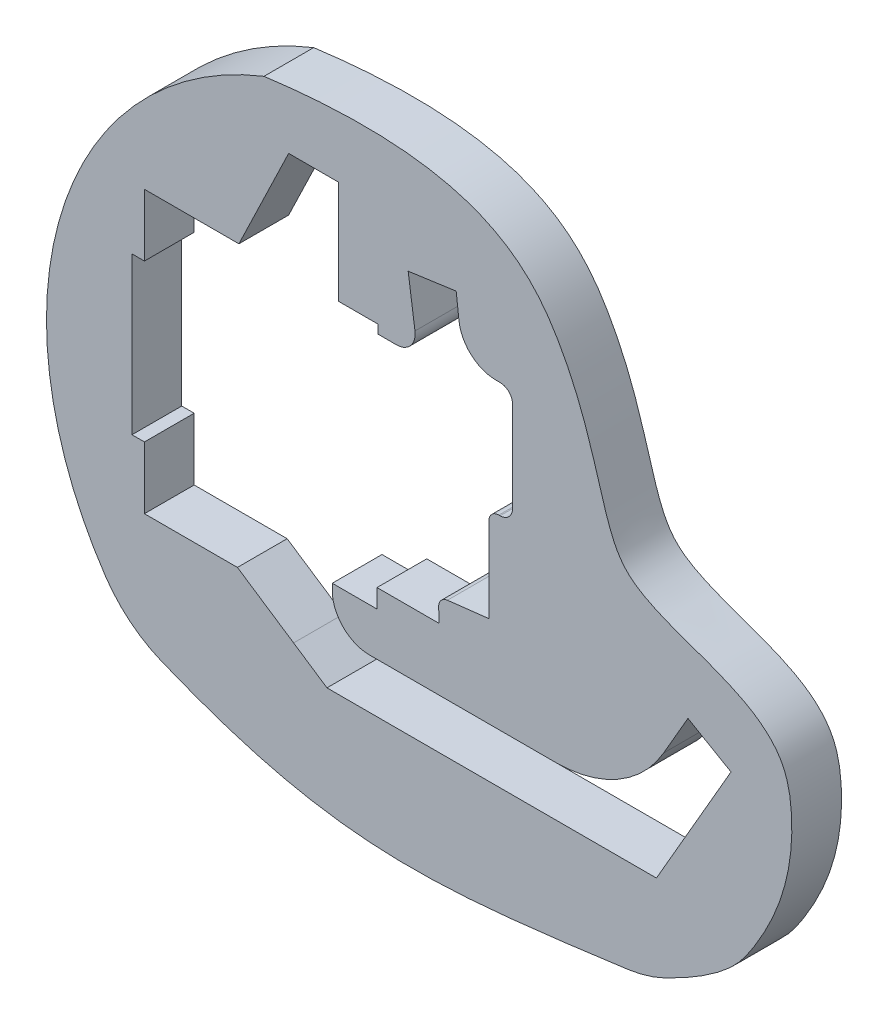
from build123d import *

# Parameters (mm, degrees)
ESTRUSIONE_ESTRUSIONE1_DEPTH = 4
RACCORDO3_START              = -1
RACCORDO3_DEPTH              = 6
RACCORDO4_R                  = 10


with BuildPart() as part:
    # Schizzo2 → Estrusione-Estrusione1 (new body)
    with BuildSketch(Plane.XY):
        with BuildLine():
            Line((3.640319886, 7.780815965), (3.640319886, 6.280815965))
            Line((3.640319886, 6.280815965), (0.040319886, 6.280815965))
            Line((0.040319886, 6.280815965), (0.040319886, 5.780815965))
            ThreePointArc((0.040319886, 5.780815965), (0.918999542, 3.659495621), (3.040319886, 2.780815965))
            Line((3.040319886, 2.780815965), (3.960236594, 2.780815965))
            Line((3.960236594, 2.780815965), (18.031328579, 2.780815965))
            ThreePointArc((18.031328579, 2.780815965), (23.031328579, 4.120561927), (26.691582617, 7.780815965))
            Line((26.691582617, 7.780815965), (28.650130733, 11.17312081))
            Line((28.650130733, 11.17312081), (32.058211867, 9.20546425))
            ThreePointArc((32.058211867, 9.20546425), (32.268457074, 11.164223077), (32.338657667, 13.13298184))
            ThreePointArc((32.338657667, 13.13298184), (32.321885242, 14.095768504), (32.271588322, 15.057386772))
            add(Edge.make_bspline(
                [(32.271588322, 15.057386772), (29.27875689, 16.431735034), (24.350017863, 17.407945559), (21.571413182, 22.441641974), (20.161959754, 31.891254738), (11.432219565, 41.073770322), (-5.452207486, 38.84415344)],
                knots=[0.516692763, 0.516692763, 0.516692763, 0.516692763, 0.651477842, 0.697425452, 0.848708318, 1, 1, 1, 1], degree=3))
            ThreePointArc((-5.452207486, 38.84415344), (-22.14676541, 19.727466002), (-16.210501275, -4.948772995))
            add(Edge.make_bspline(
                [(-16.210501275, -4.948772995), (-1.49288887, -11.445150266), (6.116781831, -11.072285097), (21.136399607, -9.088858787)],
                knots=[0, 0, 0, 0, 0.920032932, 0.920032932, 0.920032932, 0.920032932], degree=3))
            ThreePointArc((21.136399607, -9.088858787), (28.385746516, -1.111509123), (32.032748698, 9.031986988))
            Line((32.032748698, 9.031986988), (26.114232348, -1.219184035))
            Line((26.114232348, -1.219184035), (-0.385767652, -1.219184035))
            Line((-0.385767652, -1.219184035), (-3.066935067, 0.569685961))
            Line((-3.066935067, 0.569685961), (-7.586453187, 3.569685961))
            Line((-7.586453187, 3.569685961), (-15.066935067, 3.569685961))
            Line((-15.066935067, 3.569685961), (-15.066935067, 8.569685961))
            Line((-15.066935067, 8.569685961), (-16.066935067, 8.569685961))
            Line((-16.066935067, 8.569685961), (-16.066935067, 21.169685961))
            Line((-16.066935067, 21.169685961), (-15.066935067, 21.169685961))
            Line((-15.066935067, 21.169685961), (-15.066935067, 26.169685961))
            Line((-15.066935067, 26.169685961), (-7.466935067, 26.169685961))
            Line((-7.466935067, 26.169685961), (-3.466935067, 34.469685961))
            Line((-3.466935067, 34.469685961), (0.533064933, 34.469685961))
            Line((0.533064933, 34.469685961), (0.533064933, 26.169685961))
            Line((0.533064933, 26.169685961), (3.733064933, 26.169685961))
            Line((3.733064933, 26.169685961), (3.733064933, 25.469685961))
            Line((3.733064933, 25.469685961), (5.207512322, 25.469685961))
            ThreePointArc((5.207512322, 25.469685961), (6.339576692, 25.985597417), (6.692914425, 27.178445612))
            Line((6.692914425, 27.178445612), (6.146036258, 31.069685961))
            Line((6.146036258, 31.069685961), (10.008081726, 31.612461055))
            Line((10.008081726, 31.612461055), (10.233104089, 29.667649603))
            ThreePointArc((10.233104089, 29.667649603), (11.217531322, 27.772546508), (13.213222386, 27.012461055))
            Line((13.213222386, 27.012461055), (13.540319886, 27.012461055))
            ThreePointArc((13.540319886, 27.012461055), (14.247426667, 26.719567836), (14.540319886, 26.012461055))
            Line((14.540319886, 26.012461055), (14.540319886, 18.730190606))
            ThreePointArc((14.540319886, 18.730190606), (14.247426667, 18.023083824), (13.540319886, 17.730190606))
            Line((13.540319886, 17.730190606), (13.440319886, 17.730190606))
            ThreePointArc((13.440319886, 17.730190606), (12.874634461, 17.49587603), (12.640319886, 16.930190606))
            Line((12.640319886, 16.930190606), (12.640319886, 10.115073013))
            Line((12.640319886, 10.115073013), (9.303888163, 9.729034692))
            ThreePointArc((9.303888163, 9.729034692), (8.788245287, 9.454750966), (8.596448447, 8.903087019))
            Line((8.596448447, 8.903087019), (8.640319886, 7.780815965))
            Line((8.640319886, 7.780815965), (3.640319886, 7.780815965))
        make_face()
        with BuildLine():
            ThreePointArc((32.338657667, 13.13298184), (32.268457074, 11.164223077), (32.058211867, 9.20546425))
            Line((32.058211867, 9.20546425), (32.114232348, 9.17312081))
            Line((32.114232348, 9.17312081), (32.032748698, 9.031986988))
            ThreePointArc((32.032748698, 9.031986988), (28.385746516, -1.111509123), (21.136399607, -9.088858787))
            add(Edge.make_bspline(
                [(21.136399607, -9.088858787), (22.44186896, -8.916464103), (23.803318031, -8.731902158), (25.23027976, -8.538625982)],
                knots=[0.920032932, 0.920032932, 0.920032932, 0.920032932, 1, 1, 1, 1], degree=3))
            add(Edge.make_bspline(
                [(25.23027976, -8.538625982), (25.268555302, -8.535378991), (31.202921191, -6.122292501), (35.344054164, -0.1511676), (37.50134118, 4.947622679), (36.577602602, 12.518347442), (34.08153996, 14.226232748), (32.271588322, 15.057386772)],
                knots=[0, 0, 0, 0, 0.170613492, 0.21142775, 0.386285373, 0.435179828, 0.516692763, 0.516692763, 0.516692763, 0.516692763], degree=3))
            ThreePointArc((32.271588322, 15.057386772), (32.321885242, 14.095768504), (32.338657667, 13.13298184))
        make_face()
    extrude(amount=ESTRUSIONE_ESTRUSIONE1_DEPTH)

    # Raccordo3: read off the stored shape, not the designer's step
    # Raccordo3 outline → Raccordo3 (cut)
    with BuildSketch(Plane.XY.offset(RACCORDO3_START)):
        with BuildLine():
            add(Edge.make_bspline(
                [(25.23027976, -8.538625982), (25.244329167, -8.537434142), (25.898428533, -8.274319798), (26.839523473, -7.817885569)],
                knots=[0, 0, 0, 0, 0.062625331, 0.062625331, 0.062625331, 0.062625331], degree=3))
            ThreePointArc((26.839523473, -7.817885569), (25.363445579, -8.394250873), (23.814855306, -8.730213783))
            add(Edge.make_bspline(
                [(23.814855306, -8.730213783), (24.279519769, -8.667420508), (24.751207674, -8.603514352), (25.23027976, -8.538625982)],
                knots=[0.973152756, 0.973152756, 0.973152756, 0.973152756, 1, 1, 1, 1], degree=3))
        make_face()
    extrude(amount=RACCORDO3_DEPTH, mode=Mode.SUBTRACT)

    # Raccordo4
    raccordo4_edges = [part.edges().sort_by_distance(p)[0] for p in [
        (-16.210501275, -4.948772995, 2),
    ]]
    fillet(raccordo4_edges, radius=RACCORDO4_R)


solid = part.part
